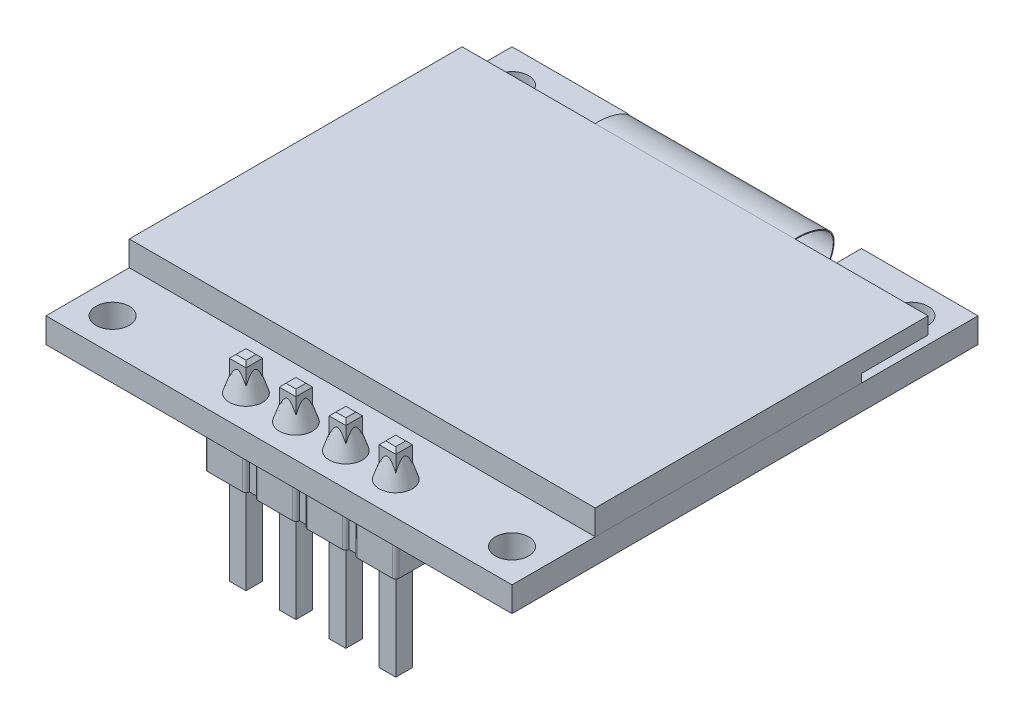
from build123d import *

# Parameters (mm, degrees)
BOSS_EXTRUDE1_DEPTH      = 1.5
SKETCH2_W                = 28
SKETCH2_H                = 16
BOSS_EXTRUDE2_DEPTH      = 1.5
SKETCH3_W                = 4
SKETCH3_H                = 1
BOSS_EXTRUDE3_DEPTH      = 28
BOSS_EXTRUDE4_START      = -20
BOSS_EXTRUDE4_DEPTH      = 12
FILLET1_R                = 0.2
SKETCH5_R                = 1
CUT_EXTRUDE1_DEPTH       = 20.870909964
BOSS_EXTRUDE5_DEPTH      = 2
BOSS_EXTRUDE5_DEPTH_BACK = 10
SKETCH6_W                = 1
SKETCH6_H                = 1
SKETCH7_W                = 2.5
SKETCH7_H                = 2.5
BOSS_EXTRUDE6_DEPTH      = 2.5
BOSS_EXTRUDE6_2_DEPTH    = 2.5
BOSS_EXTRUDE6_3_DEPTH    = 2.5
BOSS_EXTRUDE6_4_DEPTH    = 2.5
SKETCH8_W                = 11.125107546
SKETCH8_H                = 2.079045943
BOSS_EXTRUDE7_DEPTH      = 2.5
FILLET2_R                = 0.2
FILLET3_R                = 0.2
FILLET4_R                = 0.2
FILLET5_R                = 0.2
CHAMFER1_SIZE            = 0.2
LPATTERN2_COUNT          = 4
LPATTERN2_PITCH          = 3


# Read off the part's stored shape, not the designer's step: Boss-Extrude4
with BuildPart() as part:
    # Sketch1 → Boss-Extrude1 (new body)
    with BuildSketch(Plane(origin=(0, 0, 0), x_dir=(1, 0, 0), z_dir=(0, 1, 0))):
        with BuildLine():
            Line((7, 14), (14, 14))
            Line((14, 14), (14, -14))
            Line((14, -14), (-14, -14))
            Line((-14, -14), (-14, 14))
            Line((-14, 14), (-7, 14))
            Line((-7, 14), (-7, 12.5))
            ThreePointArc((-7, 12.5), (-6.853553391, 12.146446609), (-6.5, 12))
            Line((-6.5, 12), (6.5, 12))
            ThreePointArc((6.5, 12), (6.853553391, 12.146446609), (7, 12.5))
            Line((7, 12.5), (7, 14))
        make_face()
    extrude(amount=BOSS_EXTRUDE1_DEPTH)

    # Fillet1
    fillet1_edges = [part.edges().sort_by_distance(p)[0] for p in [
        (-7, 0, -13.25),
        (-6.853553391, 0, -12.146446609),
        (0, 0, -12),
        (6.853553391, 0, -12.146446609),
        (7, 0, -13.25),
    ]]
    fillet(fillet1_edges, radius=FILLET1_R)

    # Sketch5 → Cut-Extrude1 (cut, through all)
    with BuildSketch(Plane(origin=(0, 1.5, 0), x_dir=(1, 0, 0), z_dir=(0, 1, 0))):
        with Locations(Location((-12, 12, 0), (0, 0, 270))):
            Circle(SKETCH5_R)
        with Locations(Location((-12, -12, 0), (0, 0, 270))):
            Circle(SKETCH5_R)
        with Locations(Location((12, -12, 0), (0, 0, 270))):
            Circle(SKETCH5_R)
        with Locations(Location((12, 12, 0), (0, 0, 270))):
            Circle(SKETCH5_R)
    extrude(amount=-CUT_EXTRUDE1_DEPTH, mode=Mode.SUBTRACT)

    # Sketch6 → Boss-Extrude5 (add, two sides: drawn at the far end of the back side and taken through both)
    with BuildSketch(Plane(origin=(0, 1.5, 0), x_dir=(1, 0, 0), z_dir=(0, 1, 0)).offset(-BOSS_EXTRUDE5_DEPTH_BACK)):
        with Locations((-3.983110737, -12)):
            Rectangle(SKETCH6_W, SKETCH6_H)
        with Locations((2.016889263, -12)):
            Rectangle(SKETCH6_W, SKETCH6_H)
        with Locations((-0.983110737, -12)):
            Rectangle(SKETCH6_W, SKETCH6_H)
        with Locations((5.016889263, -12)):
            Rectangle(SKETCH6_W, SKETCH6_H)
    extrude(amount=BOSS_EXTRUDE5_DEPTH + BOSS_EXTRUDE5_DEPTH_BACK)

    # Chamfer1
    chamfer1_edges = [part.edges().sort_by_distance(p)[0] for p in [
        (-3.483110737, -8.5, 12),
        (-3.983110737, -8.5, 12.5),
        (-4.483110737, -8.5, 12),
        (-3.983110737, -8.5, 11.5),
        (-3.483110737, 3.5, 12),
        (-3.983110737, 3.5, 11.5),
        (-4.483110737, 3.5, 12),
        (-3.983110737, 3.5, 12.5),
        (2.516889263, -8.5, 12),
        (2.016889263, -8.5, 12.5),
        (1.516889263, -8.5, 12),
        (2.016889263, -8.5, 11.5),
        (2.516889263, 3.5, 12),
        (2.016889263, 3.5, 11.5),
        (1.516889263, 3.5, 12),
        (2.016889263, 3.5, 12.5),
        (-0.483110737, -8.5, 12),
        (-0.983110737, -8.5, 12.5),
        (-1.483110737, -8.5, 12),
        (-0.983110737, -8.5, 11.5),
        (-0.483110737, 3.5, 12),
        (-0.983110737, 3.5, 11.5),
        (-1.483110737, 3.5, 12),
        (-0.983110737, 3.5, 12.5),
        (5.516889263, -8.5, 12),
        (5.016889263, -8.5, 12.5),
        (4.516889263, -8.5, 12),
        (5.016889263, -8.5, 11.5),
        (5.516889263, 3.5, 12),
        (5.016889263, 3.5, 11.5),
        (4.516889263, 3.5, 12),
        (5.016889263, 3.5, 12.5),
    ]]
    chamfer(chamfer1_edges, length=CHAMFER1_SIZE)


with BuildPart() as body_2:
    # Sketch2 → Boss-Extrude2 (new body)
    with BuildSketch(Plane(origin=(0, 1.5, 0), x_dir=(1, 0, 0), z_dir=(0, 1, 0))):
        with Locations((0, -1)):
            Rectangle(SKETCH2_W, SKETCH2_H)
    extrude(amount=BOSS_EXTRUDE2_DEPTH)

    # Sketch3 → Boss-Extrude3 (add)
    with BuildSketch(Plane(origin=(14, 0, 0), x_dir=(0, 0, -1), z_dir=(1, 0, 0))):
        with Locations((9, 2.5)):
            Rectangle(SKETCH3_W, SKETCH3_H)
    extrude(amount=-BOSS_EXTRUDE3_DEPTH)


with BuildPart() as body_3:
    # Boss-Extrude4 outline → Boss-Extrude4 (new body)
    with BuildSketch(Plane(origin=(14, 0, 0), x_dir=(0, 0, -1), z_dir=(1, 0, 0)).offset(BOSS_EXTRUDE4_START)):
        with BuildLine():
            Line((7.782810555, 0), (6.96745037, 0))
            add(Edge.make_bspline(
                [(6.96745037, 0), (10.027220275, -0.168592487), (12.765662174, -0.652356136), (13.426083061, 1.577662291), (13.094189578, 2.823620969), (11.527009619, 3.053639806), (11, 3)],
                knots=[0, 0, 0, 0, 0.527109987, 0.667678186, 0.696564374, 1, 1, 1, 1], degree=3))
            Line((11, 3), (11, 2.949741681))
            Line((11, 2.949741681), (11.005062916, 2.950256992))
            add(Edge.make_bspline(
                [(11.005062916, 2.950256992), (11.066154519, 2.956474628), (11.177431016, 2.960521447), (11.493548582, 2.947505277), (12.140919996, 2.853174383), (12.923712315, 2.552926664), (13.297139454, 2.032480033), (13.323852266, 1.515614146), (13.167383332, 0.978042512), (12.780601701, 0.383885277), (12.041284832, -0.028997975), (10.733742207, -0.174494427), (9.324755615, -0.107120618), (8.287184135, -0.033850606), (7.862889273, -0.005307576), (7.782810555, 0)],
                knots=[0, 0, 0, 0, 0.03125, 0.0625, 0.125, 0.25, 0.3125, 0.375, 0.4375, 0.5, 0.625, 0.75, 0.875, 0.9375, 0.951890183, 0.951890183, 0.951890183, 0.951890183], degree=3))
        make_face()
    extrude(amount=BOSS_EXTRUDE4_DEPTH)


with BuildPart() as body_4:
    # Sketch7 → Boss-Extrude6 (new body)
    with BuildSketch(Plane.XZ):
        with Locations((-0.983110737, 12)):
            Rectangle(SKETCH7_W, SKETCH7_H)
    extrude(amount=BOSS_EXTRUDE6_DEPTH)

    # Fillet3
    fillet3_edges = [body_4.edges().sort_by_distance(p)[0] for p in [
        (0.266889263, -1.25, 13.25),
        (0.266889263, -1.25, 10.75),
        (-2.233110737, -1.25, 10.75),
        (-2.233110737, -1.25, 13.25),
    ]]
    fillet(fillet3_edges, radius=FILLET3_R)


with BuildPart() as body_5:
    # Sketch7 → Boss-Extrude6 2 (new body)
    with BuildSketch(Plane.XZ):
        with Locations((-3.983110737, 12)):
            Rectangle(SKETCH7_W, SKETCH7_H)
    extrude(amount=BOSS_EXTRUDE6_2_DEPTH)

    # Fillet2
    fillet2_edges = [body_5.edges().sort_by_distance(p)[0] for p in [
        (-2.733110737, -1.25, 10.75),
        (-5.233110737, -1.25, 10.75),
        (-5.233110737, -1.25, 13.25),
        (-2.733110737, -1.25, 13.25),
    ]]
    fillet(fillet2_edges, radius=FILLET2_R)


with BuildPart() as body_6:
    # Sketch7 → Boss-Extrude6 3 (new body)
    with BuildSketch(Plane.XZ):
        with Locations((2.016889263, 12)):
            Rectangle(SKETCH7_W, SKETCH7_H)
    extrude(amount=BOSS_EXTRUDE6_3_DEPTH)

    # Fillet4
    fillet4_edges = [body_6.edges().sort_by_distance(p)[0] for p in [
        (3.266889263, -1.25, 13.25),
        (3.266889263, -1.25, 10.75),
        (0.766889263, -1.25, 10.75),
        (0.766889263, -1.25, 13.25),
    ]]
    fillet(fillet4_edges, radius=FILLET4_R)


with BuildPart() as body_7:
    # Sketch7 → Boss-Extrude6 4 (new body)
    with BuildSketch(Plane.XZ):
        with Locations((5.016889263, 12)):
            Rectangle(SKETCH7_W, SKETCH7_H)
    extrude(amount=BOSS_EXTRUDE6_4_DEPTH)

    # Fillet5
    fillet5_edges = [body_7.edges().sort_by_distance(p)[0] for p in [
        (6.266889263, -1.25, 13.25),
        (6.266889263, -1.25, 10.75),
        (3.766889263, -1.25, 10.75),
        (3.766889263, -1.25, 13.25),
    ]]
    fillet(fillet5_edges, radius=FILLET5_R)


with BuildPart() as body_8:
    # Sketch8 → Boss-Extrude7 (new body)
    with BuildSketch(Plane.XZ):
        with Locations((0.497503755, 12.009615154)):
            Rectangle(SKETCH8_W, SKETCH8_H)
    extrude(amount=BOSS_EXTRUDE7_DEPTH)


with BuildPart() as body_9:
    # Sketch11 → Revolve3 (revolve)
    with BuildSketch(Plane.XY.offset(12), mode=Mode.PRIVATE) as revolve3_sk:
        Polygon((-4.483110737, 2.956254209), (-4.97724522, 1.5), (-3.983110737, 1.5), (-3.983110737, 2.956254209), align=None)
    revolve(revolve3_sk.sketch.rotate(Axis((-3.983110737, 1.5, 12), (0, 1, 0)), 270), axis=Axis((-3.983110737, 1.5, 12), (0, 1, 0)))


with BuildPart() as lpattern2_1:
    # LPattern2: pattern copy
    add(body_9.part.moved(Location(Vector(1, 0, 0) * (1 * LPATTERN2_PITCH))))


with BuildPart() as lpattern2_2:
    # LPattern2: pattern copy
    add(body_9.part.moved(Location(Vector(1, 0, 0) * (2 * LPATTERN2_PITCH))))


with BuildPart() as lpattern2_3:
    # LPattern2: pattern copy
    add(body_9.part.moved(Location(Vector(1, 0, 0) * (3 * LPATTERN2_PITCH))))


solid = Compound([part.part, body_2.part, body_3.part, body_4.part, body_5.part, body_6.part, body_7.part, body_8.part, body_9.part, lpattern2_1.part, lpattern2_2.part, lpattern2_3.part])
